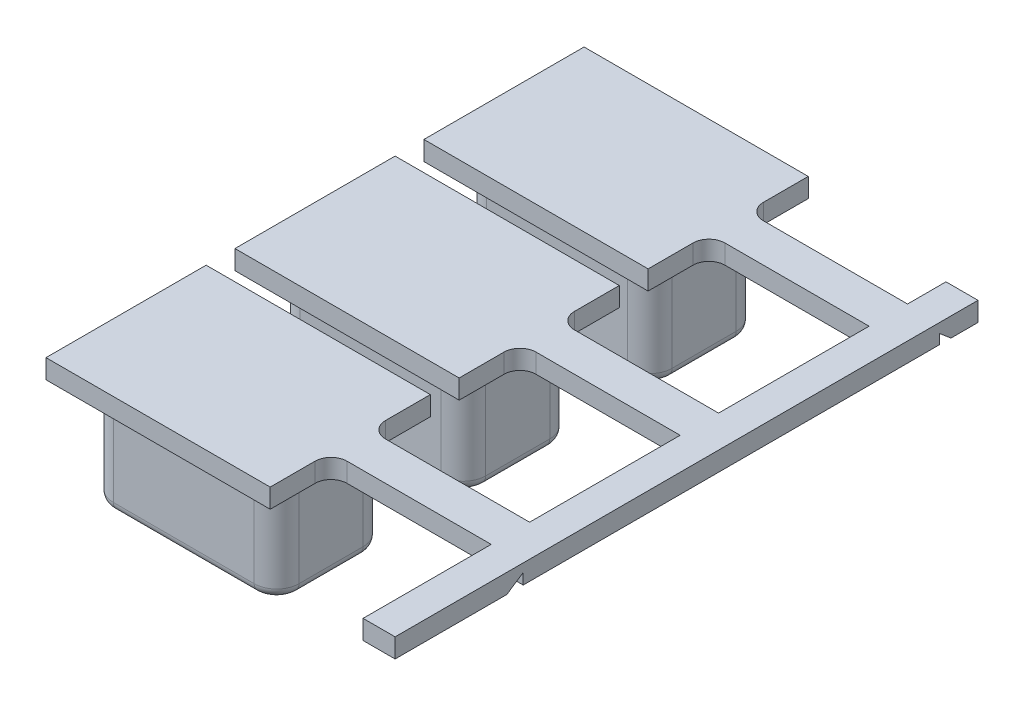
from build123d import *

# Parameters (mm, degrees)
EXTRUDE_1_DEPTH     = 4
EXTRUDE_1_2_DEPTH   = 4
EXTRUDE_1_3_DEPTH   = 4
SKETCH_2_W          = 7
SKETCH_2_H          = 5
EXTRUDE_2_DEPTH     = 0.6
SKETCH_3_W          = 6
SKETCH_3_H          = 1.2
EXTRUDE_3_DEPTH     = 0.6
SKETCH_4_W          = 1
SKETCH_4_H          = 13
EXTRUDE_4_DEPTH     = 0.6
FILLET_1_R          = 0.5
SKETCH_5_W          = 1
SKETCH_5_H          = 0.6
EXTRUDE_5_DEPTH     = 1.2
CUT_EXTRUDE_1_DEPTH = 1
FILLET_2_R          = 0.3
SKETCH_7_W          = 1
SKETCH_7_H          = 0.6
EXTRUDE_6_DEPTH     = 4
CUT_EXTRUDE_2_DEPTH = 2


with BuildPart() as part:
    # 草图1 → 凸台-拉伸1 (new body)
    with BuildSketch(Plane(origin=(0, 0, 0), x_dir=(1, 0, 0), z_dir=(0, 1, 0))):
        with BuildLine():
            Line((-2.2, 1.7), (2.2, 1.7))
            ThreePointArc((2.2, 1.7), (2.694974747, 1.494974747), (2.9, 1))
            Line((2.9, 1), (2.9, -1))
            ThreePointArc((2.9, -1), (2.694974747, -1.494974747), (2.2, -1.7))
            Line((2.2, -1.7), (-2.2, -1.7))
            ThreePointArc((-2.2, -1.7), (-2.694974747, -1.494974747), (-2.9, -1))
            Line((-2.9, -1), (-2.9, 1))
            ThreePointArc((-2.9, 1), (-2.694974747, 1.494974747), (-2.2, 1.7))
        make_face()
    extrude(amount=EXTRUDE_1_DEPTH)



with BuildPart() as body_2:
    # 草图1 → Extrude 1 2 (new body)
    with BuildSketch(Plane(origin=(0, 0, 0), x_dir=(1, 0, 0), z_dir=(0, 1, 0))):
        with BuildLine():
            Line((-2.2, 7.528722779), (2.2, 7.528722779))
            ThreePointArc((2.2, 7.528722779), (2.694974747, 7.323697526), (2.9, 6.828722779))
            Line((2.9, 6.828722779), (2.9, 4.828722779))
            ThreePointArc((2.9, 4.828722779), (2.694974747, 4.333748032), (2.2, 4.128722779))
            Line((2.2, 4.128722779), (-2.2, 4.128722779))
            ThreePointArc((-2.2, 4.128722779), (-2.694974747, 4.333748032), (-2.9, 4.828722779))
            Line((-2.9, 4.828722779), (-2.9, 6.828722779))
            ThreePointArc((-2.9, 6.828722779), (-2.694974747, 7.323697526), (-2.2, 7.528722779))
        make_face()
    extrude(amount=EXTRUDE_1_2_DEPTH)


with BuildPart() as body_3:
    # 草图1 → Extrude 1 3 (new body)
    with BuildSketch(Plane(origin=(0, 0, 0), x_dir=(1, 0, 0), z_dir=(0, 1, 0))):
        with BuildLine():
            Line((-2.2, 13.349128593), (2.2, 13.349128593))
            ThreePointArc((2.2, 13.349128593), (2.694974747, 13.144103339), (2.9, 12.649128593))
            Line((2.9, 12.649128593), (2.9, 10.649128593))
            ThreePointArc((2.9, 10.649128593), (2.694974747, 10.154153846), (2.2, 9.949128593))
            Line((2.2, 9.949128593), (-2.2, 9.949128593))
            ThreePointArc((-2.2, 9.949128593), (-2.694974747, 10.154153846), (-2.9, 10.649128593))
            Line((-2.9, 10.649128593), (-2.9, 12.649128593))
            ThreePointArc((-2.9, 12.649128593), (-2.694974747, 13.144103339), (-2.2, 13.349128593))
        make_face()
    extrude(amount=EXTRUDE_1_3_DEPTH)


with BuildPart() as part_1:
    add(part.part)

    add(body_2.part)  # 凸台-拉伸2 merges body 2

    add(body_3.part)  # 凸台-拉伸2 merges body 3
    # 草图2 → 凸台-拉伸2 (add)
    with BuildSketch(Plane(origin=(0, 4, 0), x_dir=(1, 0, 0), z_dir=(0, 1, 0))):
        with Locations((0.036699987, 11.763062551)):
            Rectangle(SKETCH_2_W, SKETCH_2_H)
        with Locations((0.036699987, 5.863062551)):
            Rectangle(SKETCH_2_W, SKETCH_2_H)
        with Locations((0.036699987, -0.036937449)):
            Rectangle(SKETCH_2_W, SKETCH_2_H)
    extrude(amount=-EXTRUDE_2_DEPTH)

    # 草图3 → 凸台-拉伸3 (add)
    with BuildSketch(Plane(origin=(0, 4, 0), x_dir=(1, 0, 0), z_dir=(0, 1, 0))):
        with Locations((6.536699987, 11.763062551)):
            Rectangle(SKETCH_3_W, SKETCH_3_H)
        with Locations((6.536699987, 5.863062551)):
            Rectangle(SKETCH_3_W, SKETCH_3_H)
        with Locations((6.536699987, -0.036937449)):
            Rectangle(SKETCH_3_W, SKETCH_3_H)
    extrude(amount=-EXTRUDE_3_DEPTH)

    # 草图4 → 凸台-拉伸4 (add)
    with BuildSketch(Plane.XZ.offset(-3.4)):
        with Locations((9.036699987, -5.863062551)):
            Rectangle(SKETCH_4_W, SKETCH_4_H)
    extrude(amount=-EXTRUDE_4_DEPTH)

    # 圆角1
    fillet_1_edges = [part_1.edges().sort_by_distance(p)[0] for p in [
        (3.536699987, 3.7, -12.363062551),
        (3.536699987, 3.7, -11.163062551),
        (3.536699987, 3.7, -5.263062551),
        (3.536699987, 3.7, -6.463062551),
        (3.536699987, 3.7, 0.636937449),
        (3.536699987, 3.7, -0.563062551),
    ]]
    fillet(fillet_1_edges, radius=FILLET_1_R)

    # 草图5 → 凸台-拉伸5 (add)
    with BuildSketch(Plane(origin=(0, 0, -12.363062551), x_dir=(-1, 0, 0), z_dir=(0, 0, -1))):
        with Locations((-9.036699987, 3.7)):
            Rectangle(SKETCH_5_W, SKETCH_5_H)
    extrude(amount=EXTRUDE_5_DEPTH)

    # 草图6 → 切除-拉伸1 (cut)
    with BuildSketch(Plane.ZY.offset(-8.536699987)):
        Polygon((-12.363062551, 3.4), (-12.363062551, 3.7), (-12.720178884, 3.4), align=None)
    extrude(amount=-CUT_EXTRUDE_1_DEPTH, mode=Mode.SUBTRACT)

    # 圆角2
    fillet_2_edges = [part_1.edges().sort_by_distance(p)[0] for p in [
        (2.694974747, 0, -13.144103339),
        (2.9, 0, -11.649128593),
        (2.694974747, 0, -10.154153846),
        (0, 0, -9.949128593),
        (-2.694974747, 0, -10.154153846),
        (-2.9, 0, -11.649128593),
        (-2.694974747, 0, -13.144103339),
        (2.694974747, 0, -7.323697526),
        (2.9, 0, -5.828722779),
        (2.694974747, 0, -4.333748032),
        (0, 0, -4.128722779),
        (-2.694974747, 0, -4.333748032),
        (-2.9, 0, -5.828722779),
        (-2.694974747, 0, -7.323697526),
        (2.694974747, 0, -1.494974747),
        (2.9, 0, 0),
        (2.694974747, 0, 1.494974747),
        (0, 0, 1.7),
        (-2.694974747, 0, 1.494974747),
        (-2.9, 0, 0),
        (-2.694974747, 0, -1.494974747),
        (0, 0, -13.349128593),
        (0, 0, -7.528722779),
        (0, 0, -1.7),
    ]]
    fillet(fillet_2_edges, radius=FILLET_2_R)

    # 草图7 → 凸台-拉伸6 (add)
    with BuildSketch(Plane.XY.offset(0.636937449)):
        with Locations((9.036699987, 3.7)):
            Rectangle(SKETCH_7_W, SKETCH_7_H)
    extrude(amount=EXTRUDE_6_DEPTH)

    # 草图8 → 切除-拉伸2 (cut)
    with BuildSketch(Plane(origin=(9.536699987, 0, 0), x_dir=(0, 0, -1), z_dir=(1, 0, 0))):
        Polygon((-0.636937449, 3.4), (-0.636937449, 3.739099035), (-1.149197187, 3.4), align=None)
    extrude(amount=-CUT_EXTRUDE_2_DEPTH, mode=Mode.SUBTRACT)


solid = part_1.part
